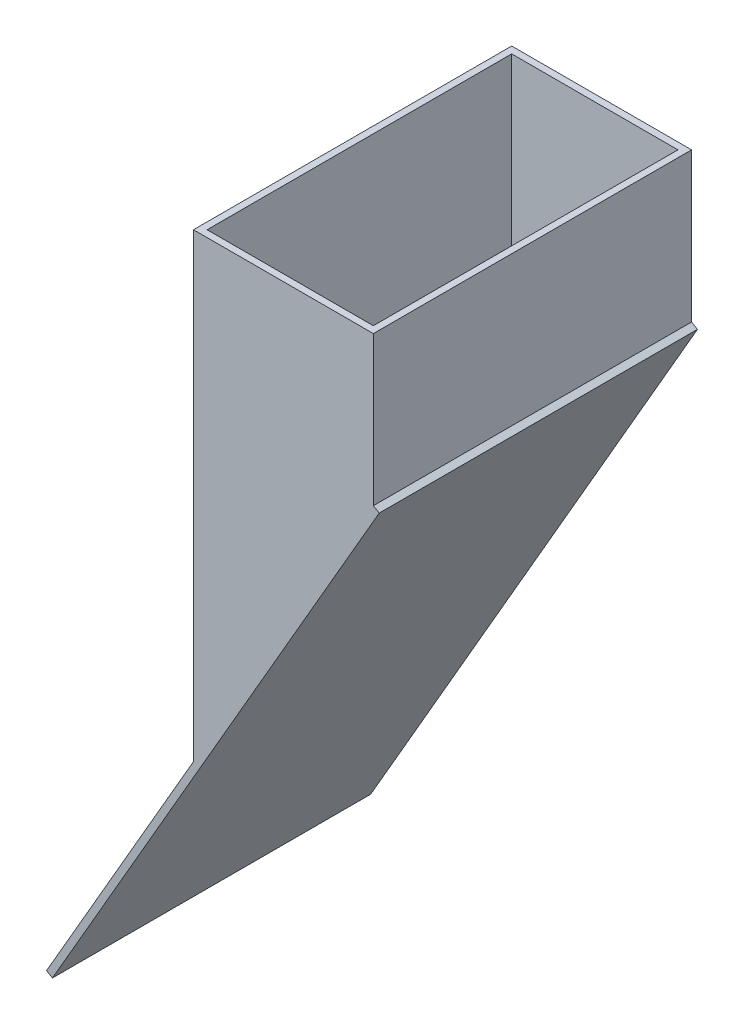
from build123d import *

# Parameters (mm, degrees)
BOSS_EXTRUDE1_REACH            = 966.862
SKETCH1_W                      = 167.7
SKETCH1_H                      = 296.7
SKETCH1_W_2                    = 155
SKETCH1_H_2                    = 284
SKETCH3_W                      = 296.7
SKETCH3_H                      = 609.4
BOSS_EXTRUDE2_DEPTH            = 6.35
CUT_EXTRUDE1_REACH             = 722.827
CUT_EXTRUDE1_DIRECTION_2_REACH = 722.827


with BuildPart() as part:
    # Boss-Extrude1: up to this plane
    boss_extrude1_end = Plane(origin=(123.076905284, -71.058484397, 0), z_dir=(-0.8660254037844398, 0.499999999999998, 0))
    # Sketch1 → Boss-Extrude1 (new, up to the surface)
    with BuildSketch(Plane(origin=(0, 0, 0), x_dir=(1, 0, 0), z_dir=(0, 1, 0)), mode=Mode.PRIVATE) as boss_extrude1_sk1:
        Rectangle(SKETCH1_W, SKETCH1_H)
        Rectangle(SKETCH1_W_2, SKETCH1_H_2, mode=Mode.SUBTRACT)
    boss_extrude1_tool1 = split(extrude(boss_extrude1_sk1.sketch, amount=-BOSS_EXTRUDE1_REACH, mode=Mode.PRIVATE), bisect_by=boss_extrude1_end, keep=Keep.BOTH, mode=Mode.PRIVATE)
    add(boss_extrude1_tool1.solids().sort_by_distance((0, 0, -144.94186))[0])

    # Sketch3 → Boss-Extrude2 (add)
    with BuildSketch(Plane(origin=(123.076905284, -71.058484397, 0), x_dir=(0, 0, -1), z_dir=(-0.8660254037844398, 0.499999999999998, 0))):
        with Locations((0, 383.153810568)):
            Rectangle(SKETCH3_W, SKETCH3_H)
    extrude(amount=-BOSS_EXTRUDE2_DEPTH)

    # Cut-Extrude1: up to this face of the body (flat: up to its plane)
    cut_extrude1_end = Plane(part.part.faces().sort_by_distance((-12.200197076, -152.682649393, -142))[0])
    # Sketch4 → Cut-Extrude1 (cut, up to the picked face)
    with BuildSketch(Plane.XY, mode=Mode.PRIVATE) as cut_extrude1_sk1:
        Polygon((-83.85, -429.466397801), (-77.5, -418.467875173), (-77.5, -333.467875173), (-83.85, -333.467875173), align=None)
    cut_extrude1_tool1 = split(extrude(cut_extrude1_sk1.sketch, amount=-CUT_EXTRUDE1_REACH, mode=Mode.PRIVATE), bisect_by=cut_extrude1_end, keep=Keep.BOTH, mode=Mode.PRIVATE)
    add(cut_extrude1_tool1.solids().sort_by(Axis((-80.73931, -378.7732, 0), (0, 0, -1)))[0], mode=Mode.SUBTRACT)

    # Cut-Extrude1 direction 2: up to this face of the body (flat: up to its plane)
    cut_extrude1_direction_2_end = Plane(part.part.faces().sort_by_distance((-12.200197076, -152.682649393, 142))[0])
    # Sketch4 → Cut-Extrude1 direction 2 (cut, up to the picked face)
    with BuildSketch(Plane.XY, mode=Mode.PRIVATE) as cut_extrude1_direction_2_sk1:
        Polygon((-83.85, -429.466397801), (-77.5, -418.467875173), (-77.5, -333.467875173), (-83.85, -333.467875173), align=None)
    cut_extrude1_direction_2_tool1 = split(extrude(cut_extrude1_direction_2_sk1.sketch, amount=CUT_EXTRUDE1_DIRECTION_2_REACH, mode=Mode.PRIVATE), bisect_by=cut_extrude1_direction_2_end, keep=Keep.BOTH, mode=Mode.PRIVATE)
    add(cut_extrude1_direction_2_tool1.solids().sort_by(Axis((-80.73931, -378.7732, 0), (0, 0, 1)))[0], mode=Mode.SUBTRACT)


solid = part.part
